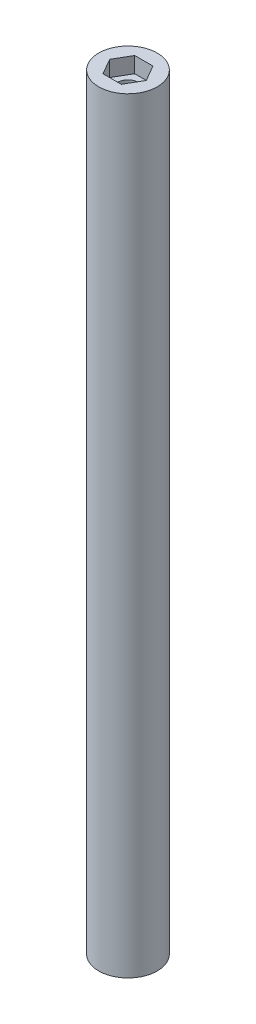
from build123d import *

# Parameters (mm, degrees)
SKETCH1_R           = 5
SKETCH1_R_2         = 1.75
BOSS_EXTRUDE1_DEPTH = 130.8
CUT_EXTRUDE1_DEPTH  = 2.7
CUT_EXTRUDE2_DEPTH  = 2.7


with BuildPart() as part:
    # Sketch1 → Boss-Extrude1 (new body)
    with BuildSketch(Plane(origin=(0, 0, 0), x_dir=(1, 0, 0), z_dir=(0, 1, 0))):
        Circle(SKETCH1_R)
        Circle(SKETCH1_R_2, mode=Mode.SUBTRACT)
    extrude(amount=BOSS_EXTRUDE1_DEPTH)

    # Sketch2 → Cut-Extrude1 (cut)
    with BuildSketch(Plane(origin=(0, 130.8, 0), x_dir=(1, 0, 0), z_dir=(0, 1, 0))):
        Polygon((3.125, 0), (1.5625, 2.706329387), (-1.5625, 2.706329387), (-3.125, 0), (-1.5625, -2.706329387), (1.5625, -2.706329387), align=None)
    extrude(amount=-CUT_EXTRUDE1_DEPTH, mode=Mode.SUBTRACT)

    # Sketch3 → Cut-Extrude2 (cut)
    with BuildSketch(Plane.XZ):
        Polygon((3.125, 0), (1.5625, 2.706329387), (-1.5625, 2.706329387), (-3.125, 0), (-1.5625, -2.706329387), (1.5625, -2.706329387), align=None)
    extrude(amount=-CUT_EXTRUDE2_DEPTH, mode=Mode.SUBTRACT)


solid = part.part
